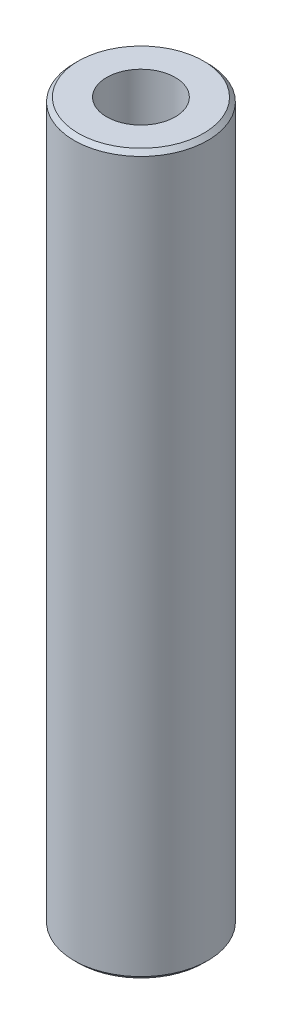
from build123d import *

# Parameters (mm, degrees)
SKETCH1_R           = 47.5
BOSS_EXTRUDE1_DEPTH = 511.052478516
SKETCH2_R           = 24.359396143
CUT_EXTRUDE1_DEPTH  = 516.448480255
CHAMFER1_SIZE       = 2.945845386


with BuildPart() as part:
    # Sketch1 → Boss-Extrude1 (new body)
    with BuildSketch(Plane(origin=(0, 0, 0), x_dir=(1, 0, 0), z_dir=(0, 1, 0))):
        Circle(SKETCH1_R)
    extrude(amount=BOSS_EXTRUDE1_DEPTH)

    # Sketch2 → Cut-Extrude1 (cut, through all)
    with BuildSketch(Plane(origin=(0, 0, 0), x_dir=(1, 0, 0), z_dir=(0, 1, 0))):
        Circle(SKETCH2_R)
    extrude(amount=CUT_EXTRUDE1_DEPTH, mode=Mode.SUBTRACT)

    # Chamfer1
    chamfer1_edges = [part.edges().sort_by_distance(p)[0] for p in [
        (-47.5, 511.052478516, 0),
        (-47.5, 0, 0),
    ]]
    chamfer(chamfer1_edges, length=CHAMFER1_SIZE)


solid = part.part
